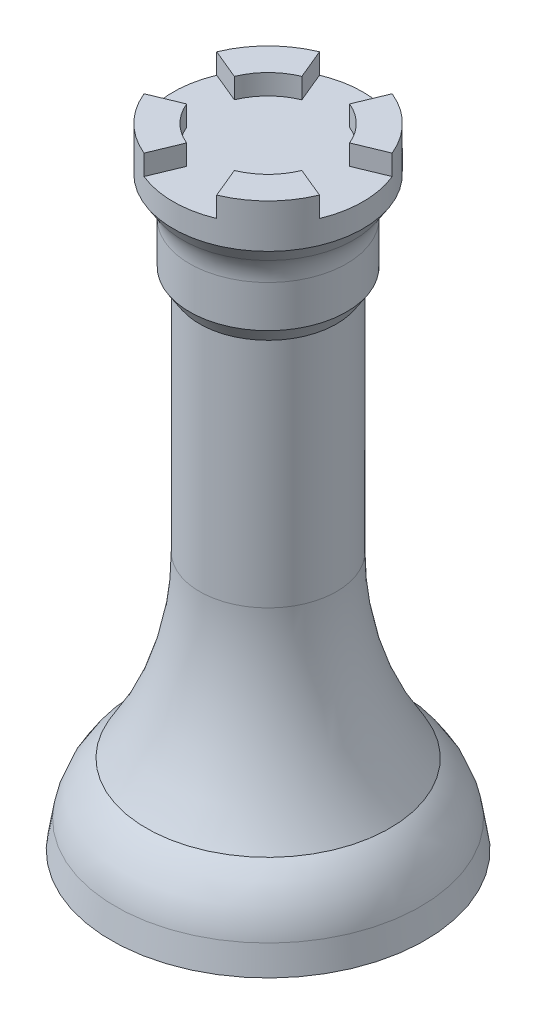
from build123d import *

# Parameters (mm, degrees)
SKETCH1_3_W        = 2.41
SKETCH1_3_H        = 1.5
CUT_REVOLVE1_ANGLE = 45
CIRPATTERN1_COUNT  = 4
CUT_EXTRUDE1_START = -0.4
SKETCH2_R          = 10
CUT_EXTRUDE1_DEPTH = 2.4


with BuildPart() as part:
    # Sketch1 → Revolve5 (revolve)
    with BuildSketch(Plane.XY):
        with BuildLine():
            Line((-7.010318738, -9.284917782), (4.589681262, -9.284917782))
            Line((4.589681262, -9.284917782), (4.589681262, 35.715082218))
            Line((4.589681262, 35.715082218), (-0.020318738, 35.715082218))
            Line((-0.020318738, 35.715082218), (-0.020318738, 37.215082218))
            Line((-0.020318738, 37.215082218), (-2.430318738, 37.215082218))
            Line((-2.430318738, 37.215082218), (-2.430318738, 33.985082218))
            Line((-2.430318738, 33.985082218), (-1.735040384, 32.910378534))
            ThreePointArc((-1.735040384, 32.910378534), (-1.343438221, 32.058018495), (-1.209241973, 31.129653665))
            Line((-1.209241973, 31.129653665), (-1.209241973, 28.047788417))
            Line((-1.209241973, 28.047788417), (-0.472655293, 26.909233745))
            Line((-0.472655293, 26.909233745), (-0.472655293, 9.778863627))
            ThreePointArc((-0.472655293, 9.778863627), (-1.478108998, 2.901044306), (-4.410318738, -3.401136412))
            ThreePointArc((-4.410318738, -3.401136412), (-5.901404916, -5.134443013), (-6.678030973, -7.284917782))
            Line((-6.678030973, -7.284917782), (-7.010318738, -9.284917782))
        make_face()
    revolve(axis=Axis((4.589681262, -9.284917782, 0), (0, 1, 0)))

    # Sketch1<3> → Cut-Revolve1 (revolve, symmetric, cut)
    with BuildSketch(Plane.XY) as cut_revolve1_sk:
        with Locations((-1.225318738, 36.465082218)):
            Rectangle(SKETCH1_3_W, SKETCH1_3_H)
    cut_revolve1 = revolve(axis=Axis((4.589681262, -9.284917782, 0), (0, 1, 0)), revolution_arc=CUT_REVOLVE1_ANGLE / 2, mode=Mode.SUBTRACT)
    cut_revolve1 = cut_revolve1 + revolve(cut_revolve1_sk.sketch, axis=Axis((4.589681262, -9.284917782, 0), (0, -1, 0)), revolution_arc=CUT_REVOLVE1_ANGLE / 2, mode=Mode.SUBTRACT)

    # CirPattern1: Cut-Revolve1 ×4 about axis
    cirpattern1_axis = Axis((4.589681262, -9.284917782, 0), (0, 1, 0))
    for i in range(1, CIRPATTERN1_COUNT):
        add(cut_revolve1.rotate(cirpattern1_axis, i * 360 / CIRPATTERN1_COUNT), mode=Mode.SUBTRACT)

    # Sketch2 → Cut-Extrude1 (cut)
    with BuildSketch(Plane.XZ.offset(9.284917782).offset(CUT_EXTRUDE1_START)):
        with Locations((4.589681262, 0)):
            Circle(SKETCH2_R)
    extrude(amount=-CUT_EXTRUDE1_DEPTH, mode=Mode.SUBTRACT)


solid = part.part
